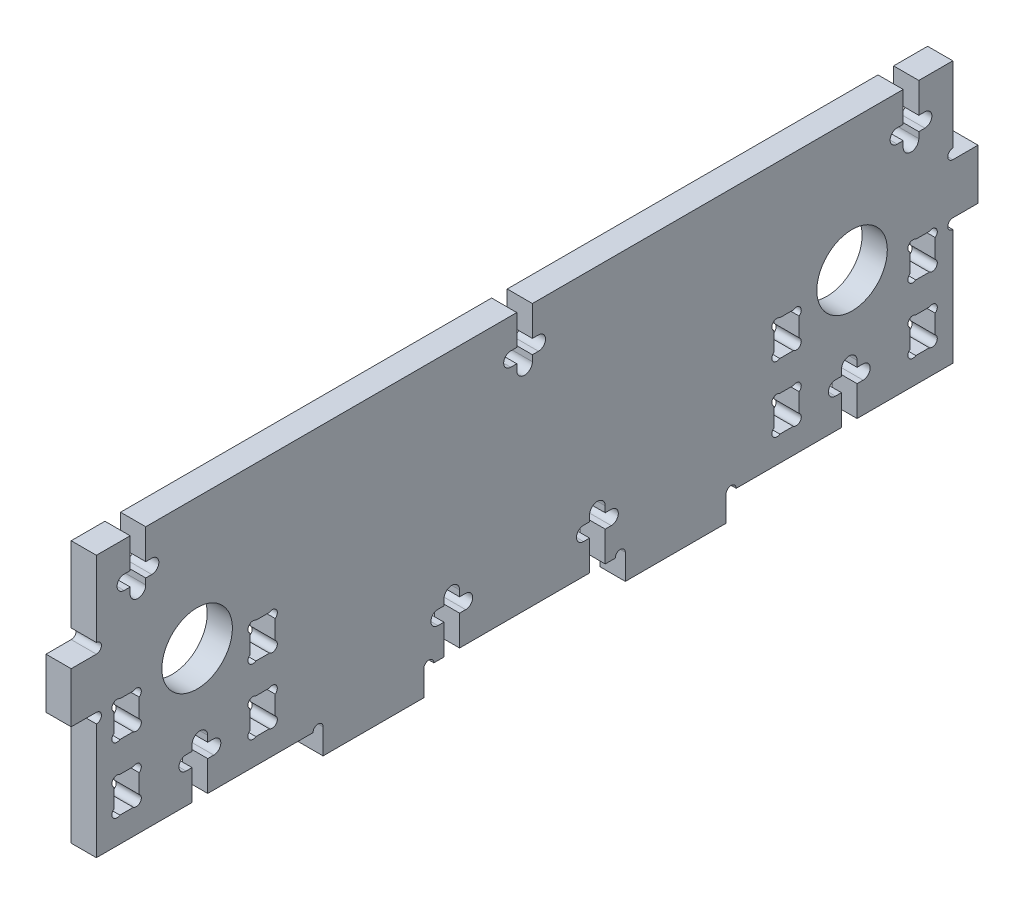
from build123d import *

# Parameters (mm, degrees)
SKETCH_1_W          = 170
SKETCH_1_H          = 52
EXTRUDE_1_DEPTH     = 5
SKETCH_2_R          = 7
CUT_EXTRUDE_1_DEPTH = 10
SKETCH_3_W          = 20
SKETCH_3_H          = 5
EXTRUDE_2_DEPTH     = 5
CUT_EXTRUDE_2_DEPTH = 10
SKETCH_8_W          = 5
SKETCH_8_H          = 10
EXTRUDE_3_DEPTH     = 5
SKETCH_7_R          = 1
CUT_EXTRUDE_3_DEPTH = 10
SKETCH_10_W         = 5
SKETCH_10_H         = 7
CUT_EXTRUDE_4_DEPTH = 10
SKETCH_11_R         = 1
CUT_EXTRUDE_5_DEPTH = 10
CUT_EXTRUDE_6_DEPTH = 10


with BuildPart() as part:
    # 스케치1 → 보스-돌출1 (new body)
    with BuildSketch(Plane(origin=(0, 0, 0), x_dir=(0, 0, -1), z_dir=(1, 0, 0))):
        with Locations((85, 26)):
            Rectangle(SKETCH_1_W, SKETCH_1_H)
    extrude(amount=EXTRUDE_1_DEPTH)

    # 스케치2 → 컷-돌출1 (cut)
    with BuildSketch(Plane(origin=(5, 0, 0), x_dir=(0, 0, -1), z_dir=(1, 0, 0))):
        with Locations((150, 26)):
            Circle(SKETCH_2_R)
        with Locations((20, 26)):
            Circle(SKETCH_2_R)
    extrude(amount=-CUT_EXTRUDE_1_DEPTH, mode=Mode.SUBTRACT)

    # 스케치3 → 보스-돌출2 (add)
    with BuildSketch(Plane(origin=(5, 0, 0), x_dir=(0, 0, -1), z_dir=(1, 0, 0))):
        with Locations((55, -2.5)):
            Rectangle(SKETCH_3_W, SKETCH_3_H)
        with Locations((115, -2.5)):
            Rectangle(SKETCH_3_W, SKETCH_3_H)
    extrude(amount=-EXTRUDE_2_DEPTH)

    # 스케치6 → 컷-돌출2 (cut)
    with BuildSketch(Plane(origin=(5, 0, 0), x_dir=(0, 0, -1), z_dir=(1, 0, 0))):
        with BuildLine():
            Line((151, 0), (151, 6))
            Line((151, 6), (152.2, 6))
            ThreePointArc((152.2, 6), (153.6, 7.4), (152.2, 8.8))
            Line((152.2, 8.8), (151, 8.8))
            Line((151, 8.8), (151, 10))
            ThreePointArc((151, 10), (149.45, 11.55), (147.9, 10))
            Line((147.9, 10), (147.9, 8.8))
            Line((147.9, 8.8), (146.7, 8.8))
            ThreePointArc((146.7, 8.8), (145.3, 7.4), (146.7, 6))
            Line((146.7, 6), (147.9, 6))
            Line((147.9, 6), (147.9, 0))
            Line((147.9, 0), (151, 0))
        make_face()
        with BuildLine():
            Line((101, 0), (101, 6))
            Line((101, 6), (102.2, 6))
            ThreePointArc((102.2, 6), (103.6, 7.4), (102.2, 8.8))
            Line((102.2, 8.8), (101, 8.8))
            Line((101, 8.8), (101, 10))
            ThreePointArc((101, 10), (99.45, 11.55), (97.9, 10))
            Line((97.9, 10), (97.9, 8.8))
            Line((97.9, 8.8), (96.7, 8.8))
            ThreePointArc((96.7, 8.8), (95.3, 7.4), (96.7, 6))
            Line((96.7, 6), (97.9, 6))
            Line((97.9, 6), (97.9, 0))
            Line((97.9, 0), (101, 0))
        make_face()
        with BuildLine():
            Line((67.8, 6), (69, 6))
            Line((69, 6), (69, 0))
            Line((69, 0), (72.1, 0))
            Line((72.1, 0), (72.1, 6))
            Line((72.1, 6), (73.3, 6))
            ThreePointArc((73.3, 6), (74.7, 7.4), (73.3, 8.8))
            Line((73.3, 8.8), (72.1, 8.8))
            Line((72.1, 8.8), (72.1, 10))
            ThreePointArc((72.1, 10), (70.55, 11.55), (69, 10))
            Line((69, 10), (69, 8.8))
            Line((69, 8.8), (67.8, 8.8))
            ThreePointArc((67.8, 8.8), (66.4, 7.4), (67.8, 6))
        make_face()
        with BuildLine():
            Line((17.8, 6), (19, 6))
            Line((19, 6), (19, 0))
            Line((19, 0), (22.1, 0))
            Line((22.1, 0), (22.1, 6))
            Line((22.1, 6), (23.3, 6))
            ThreePointArc((23.3, 6), (24.7, 7.4), (23.3, 8.8))
            Line((23.3, 8.8), (22.1, 8.8))
            Line((22.1, 8.8), (22.1, 10))
            ThreePointArc((22.1, 10), (20.55, 11.55), (19, 10))
            Line((19, 10), (19, 8.8))
            Line((19, 8.8), (17.8, 8.8))
            ThreePointArc((17.8, 8.8), (16.4, 7.4), (17.8, 6))
        make_face()
    extrude(amount=-CUT_EXTRUDE_2_DEPTH, mode=Mode.SUBTRACT)

    # 스케치8 → 보스-돌출3 (add)
    with BuildSketch(Plane(origin=(5, 0, 0), x_dir=(0, 0, -1), z_dir=(1, 0, 0))):
        with Locations((172.5, 30)):
            Rectangle(SKETCH_8_W, SKETCH_8_H)
        with Locations((-2.5, 30)):
            Rectangle(SKETCH_8_W, SKETCH_8_H)
    extrude(amount=-EXTRUDE_3_DEPTH)

    # 스케치7 → 컷-돌출3 (cut)
    with BuildSketch(Plane(origin=(5, 0, 0), x_dir=(0, 0, -1), z_dir=(1, 0, 0))):
        with Locations((66, 0)):
            Circle(SKETCH_7_R)
        with Locations((44, 0)):
            Circle(SKETCH_7_R)
        with Locations((104, 0)):
            Circle(SKETCH_7_R)
        with Locations((126, 0)):
            Circle(SKETCH_7_R)
        with Locations((170, 36)):
            Circle(SKETCH_7_R)
        with Locations((170, 24)):
            Circle(SKETCH_7_R)
        with Locations((0, 36)):
            Circle(SKETCH_7_R)
        with Locations((0, 24)):
            Circle(SKETCH_7_R)
    extrude(amount=-CUT_EXTRUDE_3_DEPTH, mode=Mode.SUBTRACT)

    # 스케치10 → 컷-돌출4 (cut)
    with BuildSketch(Plane.ZY):
        with Locations((-164, 21.5)):
            Rectangle(SKETCH_10_W, SKETCH_10_H)
        with Locations((-137, 21.5)):
            Rectangle(SKETCH_10_W, SKETCH_10_H)
        with Locations((-164, 8.5)):
            Rectangle(SKETCH_10_W, SKETCH_10_H)
        with Locations((-137, 8.5)):
            Rectangle(SKETCH_10_W, SKETCH_10_H)
        with Locations((-33, 8.5)):
            Rectangle(SKETCH_10_W, SKETCH_10_H)
        with Locations((-6, 8.5)):
            Rectangle(SKETCH_10_W, SKETCH_10_H)
        with Locations((-33, 21.5)):
            Rectangle(SKETCH_10_W, SKETCH_10_H)
        with Locations((-6, 21.5)):
            Rectangle(SKETCH_10_W, SKETCH_10_H)
    extrude(amount=-CUT_EXTRUDE_4_DEPTH, mode=Mode.SUBTRACT)

    # 스케치11 → 컷-돌출5 (cut)
    with BuildSketch(Plane(origin=(5, 0, 0), x_dir=(0, 0, -1), z_dir=(1, 0, 0))):
        with Locations((165.918761806, 24.186266529)):
            Circle(SKETCH_11_R)
        with Locations((162.081238194, 24.186266529)):
            Circle(SKETCH_11_R)
        with Locations((165.918761806, 18.813733471)):
            Circle(SKETCH_11_R)
        with Locations((162.081238194, 18.813733471)):
            Circle(SKETCH_11_R)
        with Locations((138.918761806, 18.813733471)):
            Circle(SKETCH_11_R)
        with Locations((135.081238194, 18.813733471)):
            Circle(SKETCH_11_R)
        with Locations((138.918761806, 24.186266529)):
            Circle(SKETCH_11_R)
        with Locations((135.081238194, 24.186266529)):
            Circle(SKETCH_11_R)
        with Locations((135.081238194, 5.813733471)):
            Circle(SKETCH_11_R)
        with Locations((138.918761806, 5.813733471)):
            Circle(SKETCH_11_R)
        with Locations((135.081238194, 11.186266529)):
            Circle(SKETCH_11_R)
        with Locations((138.918761806, 11.186266529)):
            Circle(SKETCH_11_R)
        with Locations((162.081238194, 11.186266529)):
            Circle(SKETCH_11_R)
        with Locations((165.918761806, 11.186266529)):
            Circle(SKETCH_11_R)
        with Locations((162.081238194, 5.813733471)):
            Circle(SKETCH_11_R)
        with Locations((165.918761806, 5.813733471)):
            Circle(SKETCH_11_R)
        with Locations((4.081238194, 5.813733471)):
            Circle(SKETCH_11_R)
        with Locations((7.918761806, 5.813733471)):
            Circle(SKETCH_11_R)
        with Locations((4.081238194, 11.186266529)):
            Circle(SKETCH_11_R)
        with Locations((7.918761806, 11.186266529)):
            Circle(SKETCH_11_R)
        with Locations((31.081238194, 11.186266529)):
            Circle(SKETCH_11_R)
        with Locations((34.918761806, 11.186266529)):
            Circle(SKETCH_11_R)
        with Locations((31.081238194, 5.813733471)):
            Circle(SKETCH_11_R)
        with Locations((34.918761806, 5.813733471)):
            Circle(SKETCH_11_R)
        with Locations((34.918761806, 24.186266529)):
            Circle(SKETCH_11_R)
        with Locations((31.081238194, 24.186266529)):
            Circle(SKETCH_11_R)
        with Locations((34.918761806, 18.813733471)):
            Circle(SKETCH_11_R)
        with Locations((31.081238194, 18.813733471)):
            Circle(SKETCH_11_R)
        with Locations((7.918761806, 18.813733471)):
            Circle(SKETCH_11_R)
        with Locations((4.081238194, 18.813733471)):
            Circle(SKETCH_11_R)
        with Locations((7.918761806, 24.186266529)):
            Circle(SKETCH_11_R)
        with Locations((4.081238194, 24.186266529)):
            Circle(SKETCH_11_R)
    extrude(amount=-CUT_EXTRUDE_5_DEPTH, mode=Mode.SUBTRACT)

    # 스케치12 → 컷-돌출6 (cut)
    with BuildSketch(Plane(origin=(5, 0, 0), x_dir=(0, 0, -1), z_dir=(1, 0, 0))):
        with BuildLine():
            Line((160.15, 52), (160.15, 46))
            Line((160.15, 46), (158.95, 46))
            ThreePointArc((158.95, 46), (157.55, 44.6), (158.95, 43.2))
            Line((158.95, 43.2), (160.15, 43.2))
            Line((160.15, 43.2), (160.15, 42))
            ThreePointArc((160.15, 42), (161.7, 40.45), (163.25, 42))
            Line((163.25, 42), (163.25, 43.2))
            Line((163.25, 43.2), (164.45, 43.2))
            ThreePointArc((164.45, 43.2), (165.85, 44.6), (164.45, 46))
            Line((164.45, 46), (163.25, 46))
            Line((163.25, 46), (163.25, 52))
            Line((163.25, 52), (160.15, 52))
        make_face()
        with BuildLine():
            Line((82.25, 46), (83.45, 46))
            Line((83.45, 46), (83.45, 52))
            Line((83.45, 52), (86.55, 52))
            Line((86.55, 52), (86.55, 46))
            Line((86.55, 46), (87.75, 46))
            ThreePointArc((87.75, 46), (89.15, 44.6), (87.75, 43.2))
            Line((87.75, 43.2), (86.55, 43.2))
            Line((86.55, 43.2), (86.55, 42))
            ThreePointArc((86.55, 42), (85, 40.45), (83.45, 42))
            Line((83.45, 42), (83.45, 43.2))
            Line((83.45, 43.2), (82.25, 43.2))
            ThreePointArc((82.25, 43.2), (80.85, 44.6), (82.25, 46))
        make_face()
        with BuildLine():
            Line((6.7, 43.2), (6.7, 42))
            ThreePointArc((6.7, 42), (8.25, 40.45), (9.8, 42))
            Line((9.8, 42), (9.8, 43.2))
            Line((9.8, 43.2), (11, 43.2))
            ThreePointArc((11, 43.2), (12.4, 44.6), (11, 46))
            Line((11, 46), (9.8, 46))
            Line((9.8, 46), (9.8, 52))
            Line((9.8, 52), (6.7, 52))
            Line((6.7, 52), (6.7, 46))
            Line((6.7, 46), (5.5, 46))
            ThreePointArc((5.5, 46), (4.1, 44.6), (5.5, 43.2))
            Line((5.5, 43.2), (6.7, 43.2))
        make_face()
    extrude(amount=-CUT_EXTRUDE_6_DEPTH, mode=Mode.SUBTRACT)


solid = part.part
